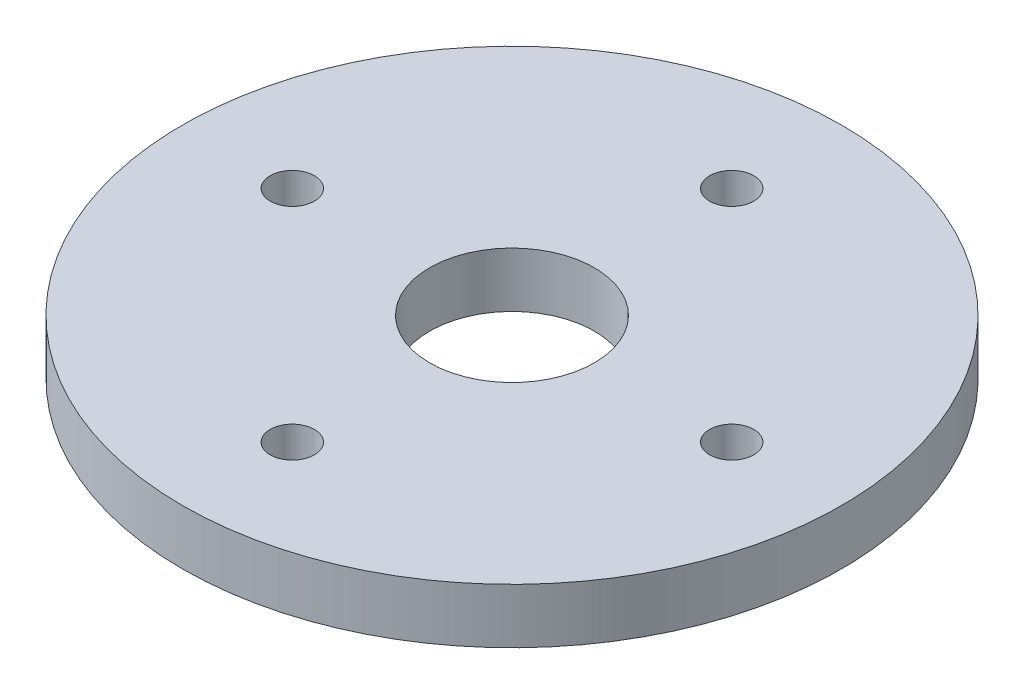
from build123d import *

# Parameters (mm, degrees)
SKETCH1_R              = 38.1
SKETCH1_R_2            = 9.525
BOSS_EXTRUDE1_DEPTH    = 6.35
F_10_CLEARANCE_HOLE1_D = 5.1054


with BuildPart() as part:
    # Sketch1 → Boss-Extrude1 (new body)
    with BuildSketch(Plane(origin=(0, 0, 0), x_dir=(1, 0, 0), z_dir=(0, 1, 0))):
        Circle(SKETCH1_R)
        Circle(SKETCH1_R_2, mode=Mode.SUBTRACT)
    extrude(amount=BOSS_EXTRUDE1_DEPTH)

    # #10 Clearance Hole1 (through all)
    with Locations(Plane(origin=(0, 6.35, 0), x_dir=(1, 0, 0), z_dir=(0, 1, 0))):
        with Locations((-25.4, 0), (0, 25.4), (25.4, 0), (0, -25.4)):
            Hole(F_10_CLEARANCE_HOLE1_D / 2)


solid = part.part
